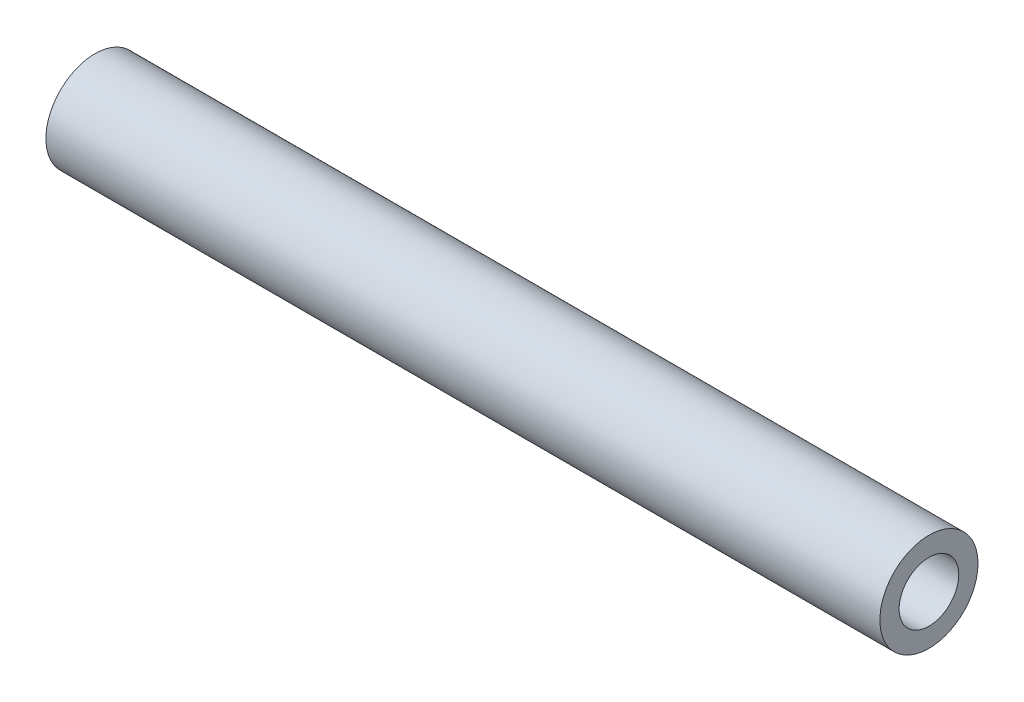
from build123d import *

# Parameters (mm, degrees)
SKETCH1_R           = 3.175
SKETCH1_R_2         = 1.9304
BOSS_EXTRUDE1_DEPTH = 26.9875


with BuildPart() as part:
    # Sketch1 → Boss-Extrude1 (new, symmetric)
    with BuildSketch(Plane(origin=(0, 0, 0), x_dir=(0, 0, -1), z_dir=(1, 0, 0))):
        Circle(SKETCH1_R)
        Circle(SKETCH1_R_2, mode=Mode.SUBTRACT)
    extrude(amount=BOSS_EXTRUDE1_DEPTH, both=True)


solid = part.part
